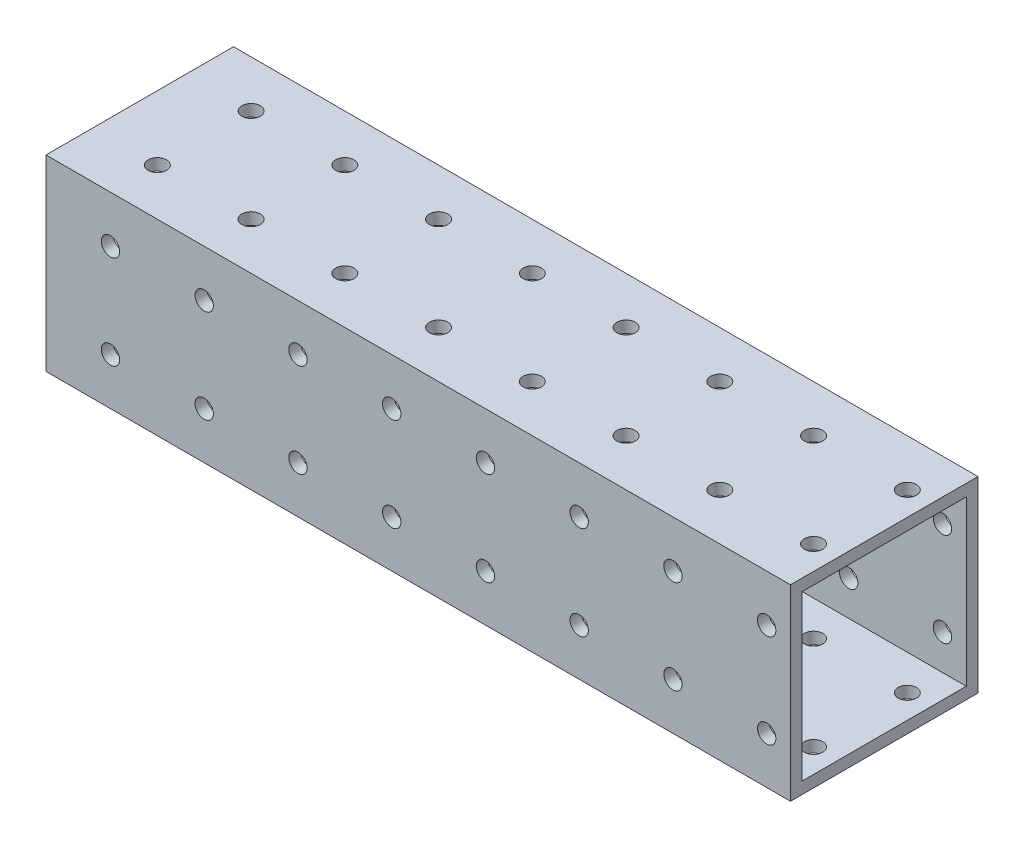
from build123d import *

# Parameters (mm, degrees)
SKETCH1_W           = 50.8
SKETCH1_H           = 50.8
BOSS_EXTRUDE1_DEPTH = 201.72011345
SHELL1_T            = -3.175
SKETCH2_R           = 2.4892
CUT_EXTRUDE3_DEPTH  = 215.13146469
SKETCH3_R           = 2.4892
CUT_EXTRUDE2_DEPTH  = 215.13146469
LPATTERN1_COUNT     = 8
LPATTERN1_PITCH     = 25.4


with BuildPart() as part:
    # Sketch1 → Boss-Extrude1 (new body)
    with BuildSketch(Plane(origin=(0, 0, 0), x_dir=(0, 0, -1), z_dir=(1, 0, 0))):
        with Locations((25.4, 25.4)):
            Rectangle(SKETCH1_W, SKETCH1_H)
    extrude(amount=BOSS_EXTRUDE1_DEPTH)

    # Shell1
    shell1_openings = [part.faces().sort_by_distance(p)[0] for p in [
        (0, 25.4, -25.4),
        (201.72011345, 25.4, -25.4),
    ]]
    offset(amount=SHELL1_T, openings=shell1_openings, kind=Kind.INTERSECTION)

    # Sketch2 → Cut-Extrude3 (cut, through all)
    with BuildSketch(Plane(origin=(0, 0, -50.8), x_dir=(-1, 0, 0), z_dir=(0, 0, -1))):
        with Locations((-195.262511684, 38.1)):
            Circle(SKETCH2_R)
        with Locations((-195.262511684, 12.7)):
            Circle(SKETCH2_R)
    cut_extrude3 = extrude(amount=-CUT_EXTRUDE3_DEPTH, mode=Mode.SUBTRACT)

    # Sketch3 → Cut-Extrude2 (cut, through all)
    with BuildSketch(Plane.XZ):
        with Locations((195.262511684, -12.7)):
            Circle(SKETCH3_R)
        with Locations((195.262511684, -38.1)):
            Circle(SKETCH3_R)
    cut_extrude2 = extrude(amount=-CUT_EXTRUDE2_DEPTH, mode=Mode.SUBTRACT)

    # LPattern1: Cut-Extrude3, Cut-Extrude2 ×8
    with Locations(*[(-i * LPATTERN1_PITCH, 0, 0) for i in range(1, LPATTERN1_COUNT)]):
        add(cut_extrude3, mode=Mode.SUBTRACT)
        add(cut_extrude2, mode=Mode.SUBTRACT)


solid = part.part
